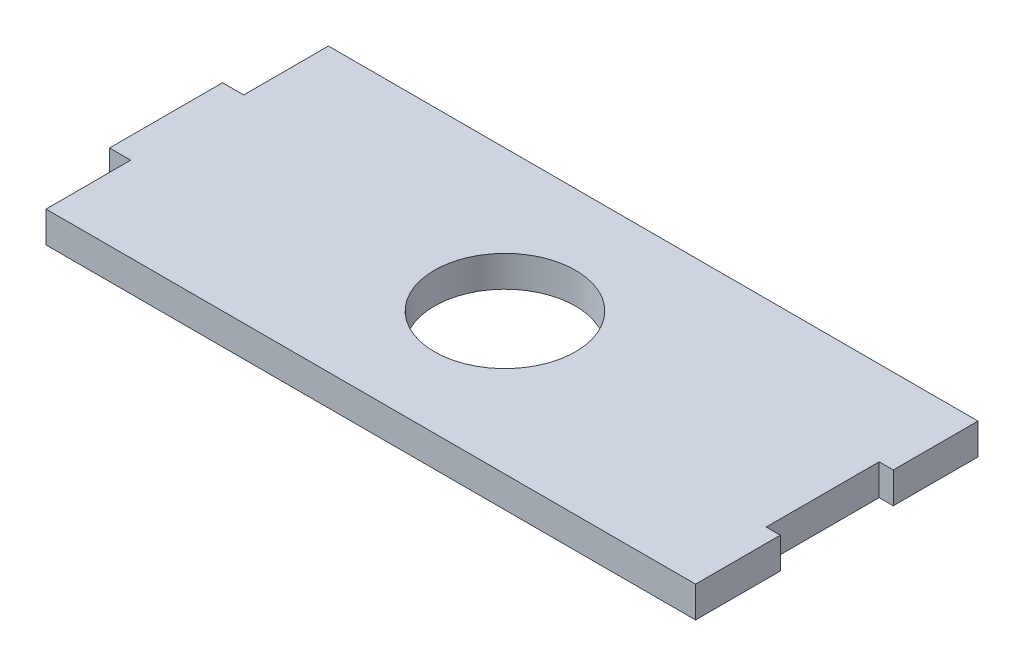
from build123d import *

# Parameters (mm, degrees)
SKETCH1_R           = 5
BOSS_EXTRUDE1_DEPTH = 2.2


with BuildPart() as part:
    # Sketch1 → Boss-Extrude1 (new body)
    with BuildSketch(Plane(origin=(0, 0, 0), x_dir=(1, 0, 0), z_dir=(0, 1, 0))):
        Polygon((-137.304574569, -23.402287284), (-138.804574569, -23.402287284), (-138.804574569, -31.402287284), (-137.304574569, -31.402287284), (-137.304574569, -37.402287284), (-91.304574569, -37.402287284), (-91.304574569, -31.402287284), (-92.304574569, -31.402287284), (-92.304574569, -23.402287284), (-91.304574569, -23.402287284), (-91.304574569, -17.402287284), (-137.304574569, -17.402287284), align=None)
        with Locations((-114.805151385, -27.402287284)):
            Circle(SKETCH1_R, mode=Mode.SUBTRACT)
    extrude(amount=BOSS_EXTRUDE1_DEPTH)


solid = part.part
